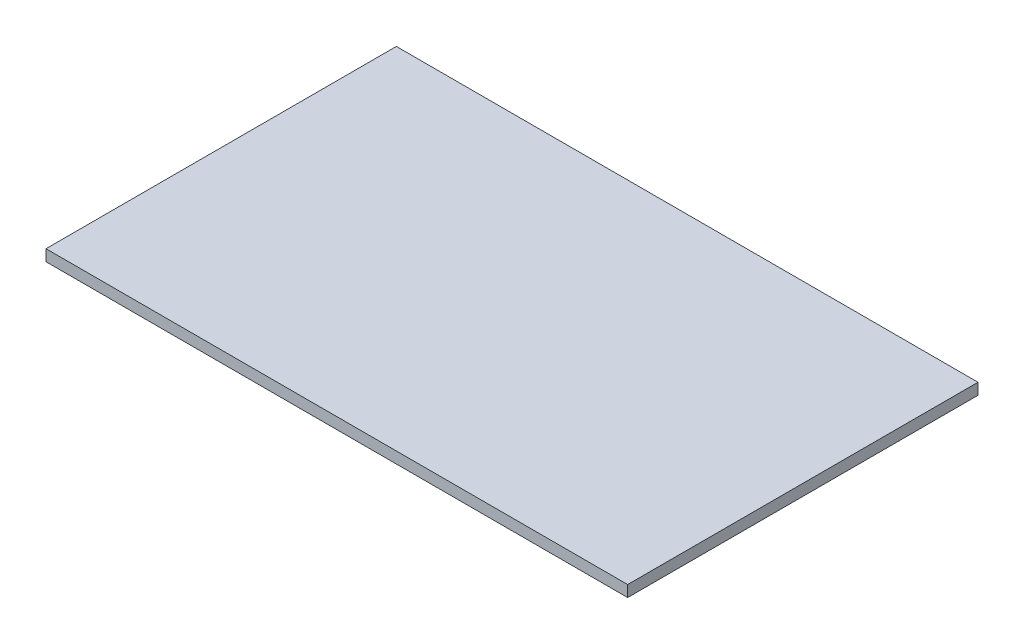
from build123d import *

# Parameters (mm, degrees)
SKETCH1_W           = 103
SKETCH1_H           = 62.04
BOSS_EXTRUDE1_DEPTH = 2


# Read off the part's stored shape, not the designer's step: Imported1
with BuildPart() as part:
    # Sketch1 → Boss-Extrude1 (new body)
    with BuildSketch(Plane(origin=(0, 2, 0), x_dir=(1, 0, 0), z_dir=(0, 1, 0))):
        Rectangle(SKETCH1_W, SKETCH1_H)
    extrude(amount=-BOSS_EXTRUDE1_DEPTH)


solid = part.part
